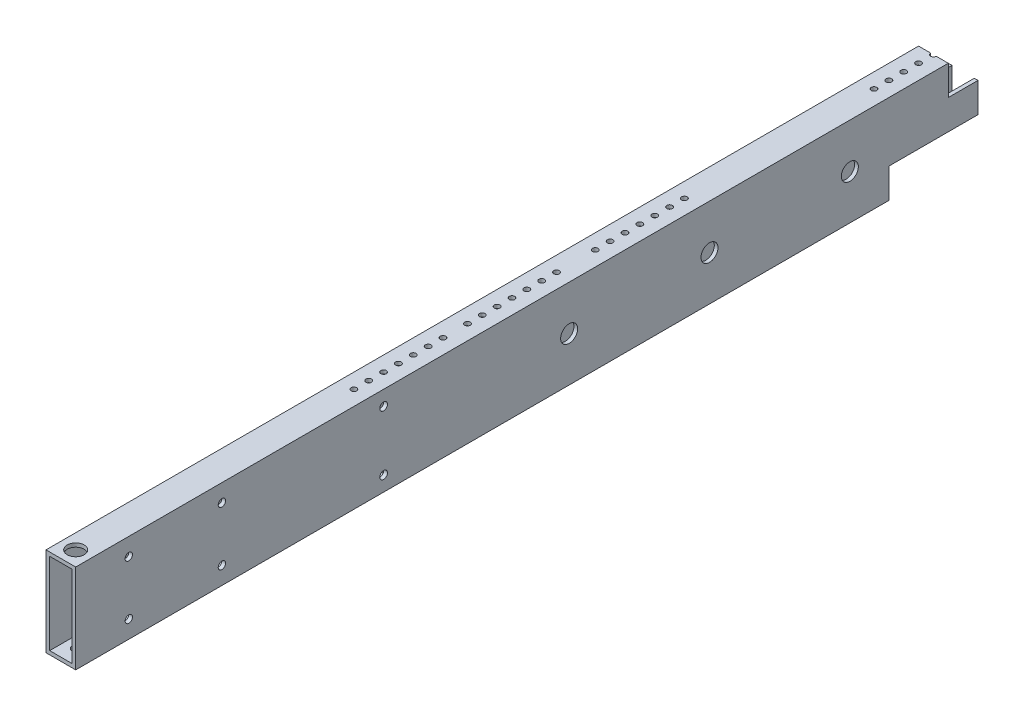
from build123d import *

# Parameters (mm, degrees)
SKETCH1_W                                    = 25.4
SKETCH1_H                                    = 76.2
BOSS_EXTRUDE1_DEPTH                          = 385.699
SHELL1_T                                     = -3.175
SKETCH2_W                                    = 76.2
SKETCH2_H                                    = 25.4
CUT_EXTRUDE1_DEPTH                           = 389.407632007
SKETCH3_W                                    = 25.4
SKETCH3_H                                    = 25.4
CUT_EXTRUDE2_DEPTH                           = 389.407632007
SKETCH4_R                                    = 2.38125
CUT_EXTRUDE3_DEPTH                           = 394.359185225
CUT_EXTRUDE4_REACH                           = 395.359
SKETCH5_R                                    = 2.38125
CUT_EXTRUDE5_REACH                           = 395.359
SKETCH6_R                                    = 2.38125
CBORE_FOR_M6_HEX_HEAD_BOLT1_D                = 6.3
CBORE_FOR_M6_HEX_HEAD_BOLT1_CBORE_D          = 14.547
CBORE_FOR_M6_HEX_HEAD_BOLT1_CBORE_DEPTH      = 4
CBORE_FOR_M6_HEX_HEAD_CAP_SCREW1_D           = 6.6
CBORE_FOR_M6_HEX_HEAD_CAP_SCREW1_CBORE_D     = 14.55
CBORE_FOR_M6_HEX_HEAD_CAP_SCREW1_CBORE_DEPTH = 4.15
CBORE_FOR_M6_HEX_HEAD_CAP_SCREW2_D           = 6.6
CBORE_FOR_M6_HEX_HEAD_CAP_SCREW2_CBORE_D     = 14.55
CBORE_FOR_M6_HEX_HEAD_CAP_SCREW2_CBORE_DEPTH = 4.15
CBORE_FOR_M6_HEX_HEAD_CAP_SCREW3_D           = 6.6
CBORE_FOR_M6_HEX_HEAD_CAP_SCREW3_CBORE_D     = 14.55
CBORE_FOR_M6_HEX_HEAD_CAP_SCREW3_CBORE_DEPTH = 4.15


with BuildPart() as part:
    # Sketch1 → Boss-Extrude1 (new, symmetric)
    with BuildSketch(Plane.XY):
        Rectangle(SKETCH1_W, SKETCH1_H)
    extrude(amount=BOSS_EXTRUDE1_DEPTH, both=True)

    # Shell1
    shell1_openings = [part.faces().sort_by_distance(p)[0] for p in [
        (0, 0, -385.699),
        (0, 0, 385.699),
    ]]
    offset(amount=SHELL1_T, openings=shell1_openings, kind=Kind.INTERSECTION)

    # Sketch2 → Cut-Extrude1 (cut, through all)
    with BuildSketch(Plane(origin=(12.7, 0, 0), x_dir=(0, 0, -1), z_dir=(1, 0, 0))):
        with Locations((347.599, -25.4)):
            Rectangle(SKETCH2_W, SKETCH2_H)
    extrude(amount=-CUT_EXTRUDE1_DEPTH, mode=Mode.SUBTRACT)

    # Sketch3 → Cut-Extrude2 (cut, through all)
    with BuildSketch(Plane(origin=(12.7, 0, 0), x_dir=(0, 0, -1), z_dir=(1, 0, 0))):
        with Locations((372.999, 25.4)):
            Rectangle(SKETCH3_W, SKETCH3_H)
    extrude(amount=-CUT_EXTRUDE2_DEPTH, mode=Mode.SUBTRACT)

    # Sketch4 → Cut-Extrude3 (cut, through all)
    with BuildSketch(Plane(origin=(0, 38.1, 0), x_dir=(1, 0, 0), z_dir=(0, 1, 0))):
        with Locations((0, 147.394483214)):
            Circle(SKETCH4_R)
        with Locations((0, 134.694483214)):
            Circle(SKETCH4_R)
        with Locations((0, 121.994483214)):
            Circle(SKETCH4_R)
        with Locations((0, 109.294483214)):
            Circle(SKETCH4_R)
        with Locations((0, 96.594483214)):
            Circle(SKETCH4_R)
        with Locations((0, 83.894483214)):
            Circle(SKETCH4_R)
        with Locations((0, 71.194483214)):
            Circle(SKETCH4_R)
        with Locations((0, 38.09873)):
            Circle(SKETCH4_R)
        with Locations((0, 25.39873)):
            Circle(SKETCH4_R)
        with Locations((0, 12.69873)):
            Circle(SKETCH4_R)
        with Locations((0, -0.00127)):
            Circle(SKETCH4_R)
        with Locations((0, -12.70127)):
            Circle(SKETCH4_R)
        with Locations((0, -25.40127)):
            Circle(SKETCH4_R)
        with Locations((0, -38.10127)):
            Circle(SKETCH4_R)
        with Locations((0, -58.99324371)):
            Circle(SKETCH4_R)
        with Locations((0, -71.69324371)):
            Circle(SKETCH4_R)
        with Locations((0, -84.39324371)):
            Circle(SKETCH4_R)
        with Locations((0, -97.09324371)):
            Circle(SKETCH4_R)
        with Locations((0, -109.79324371)):
            Circle(SKETCH4_R)
        with Locations((0, -122.49324371)):
            Circle(SKETCH4_R)
        with Locations((0, -135.19324371)):
            Circle(SKETCH4_R)
    extrude(amount=-CUT_EXTRUDE3_DEPTH, mode=Mode.SUBTRACT)

    # Sketch5 → Cut-Extrude4 (cut, up to next)
    with BuildSketch(Plane(origin=(0, 38.1, 0), x_dir=(1, 0, 0), z_dir=(0, 1, 0)), mode=Mode.PRIVATE) as cut_extrude4_sk1:
        with Locations((0, 360.299)):
            Circle(SKETCH5_R)
    cut_extrude4_tool1 = extrude(cut_extrude4_sk1.sketch, amount=-CUT_EXTRUDE4_REACH, mode=Mode.PRIVATE) & part.part
    # Sketch5 → Cut-Extrude4 (cut, up to next)
    with BuildSketch(Plane(origin=(0, 38.1, 0), x_dir=(1, 0, 0), z_dir=(0, 1, 0)), mode=Mode.PRIVATE) as cut_extrude4_sk2:
        with Locations((0, 347.599)):
            Circle(SKETCH5_R)
    cut_extrude4_tool2 = extrude(cut_extrude4_sk2.sketch, amount=-CUT_EXTRUDE4_REACH, mode=Mode.PRIVATE) & part.part
    # Sketch5 → Cut-Extrude4 (cut, up to next)
    with BuildSketch(Plane(origin=(0, 38.1, 0), x_dir=(1, 0, 0), z_dir=(0, 1, 0)), mode=Mode.PRIVATE) as cut_extrude4_sk3:
        with Locations((0, 334.899)):
            Circle(SKETCH5_R)
    cut_extrude4_tool3 = extrude(cut_extrude4_sk3.sketch, amount=-CUT_EXTRUDE4_REACH, mode=Mode.PRIVATE) & part.part
    # Sketch5 → Cut-Extrude4 (cut, up to next)
    with BuildSketch(Plane(origin=(0, 38.1, 0), x_dir=(1, 0, 0), z_dir=(0, 1, 0)), mode=Mode.PRIVATE) as cut_extrude4_sk4:
        with Locations((0, 322.199)):
            Circle(SKETCH5_R)
    cut_extrude4_tool4 = extrude(cut_extrude4_sk4.sketch, amount=-CUT_EXTRUDE4_REACH, mode=Mode.PRIVATE) & part.part
    # Sketch5 → Cut-Extrude4 (cut, up to next)
    with BuildSketch(Plane(origin=(0, 38.1, 0), x_dir=(1, 0, 0), z_dir=(0, 1, 0)), mode=Mode.PRIVATE) as cut_extrude4_sk5:
        with Locations((0, 309.499)):
            Circle(SKETCH5_R)
    cut_extrude4_tool5 = extrude(cut_extrude4_sk5.sketch, amount=-CUT_EXTRUDE4_REACH, mode=Mode.PRIVATE) & part.part
    add(cut_extrude4_tool1.solids().sort_by_distance((0, 38.1, -360.299))[0], mode=Mode.SUBTRACT)
    add(cut_extrude4_tool2.solids().sort_by_distance((0, 38.1, -347.599))[0], mode=Mode.SUBTRACT)
    add(cut_extrude4_tool3.solids().sort_by_distance((0, 38.1, -334.899))[0], mode=Mode.SUBTRACT)
    add(cut_extrude4_tool4.solids().sort_by_distance((0, 38.1, -322.199))[0], mode=Mode.SUBTRACT)
    add(cut_extrude4_tool5.solids().sort_by_distance((0, 38.1, -309.499))[0], mode=Mode.SUBTRACT)

    # Sketch6 → Cut-Extrude5 (cut, up to next)
    with BuildSketch(Plane.XZ.offset(38.1), mode=Mode.PRIVATE) as cut_extrude5_sk1:
        with Locations((0, -309.499)):
            Circle(SKETCH6_R)
    cut_extrude5_tool1 = extrude(cut_extrude5_sk1.sketch, amount=-CUT_EXTRUDE5_REACH, mode=Mode.PRIVATE) & part.part
    # Sketch6 → Cut-Extrude5 (cut, up to next)
    with BuildSketch(Plane.XZ.offset(38.1), mode=Mode.PRIVATE) as cut_extrude5_sk2:
        with Locations((0, -296.799)):
            Circle(SKETCH6_R)
    cut_extrude5_tool2 = extrude(cut_extrude5_sk2.sketch, amount=-CUT_EXTRUDE5_REACH, mode=Mode.PRIVATE) & part.part
    # Sketch6 → Cut-Extrude5 (cut, up to next)
    with BuildSketch(Plane.XZ.offset(38.1), mode=Mode.PRIVATE) as cut_extrude5_sk3:
        with Locations((0, -284.099)):
            Circle(SKETCH6_R)
    cut_extrude5_tool3 = extrude(cut_extrude5_sk3.sketch, amount=-CUT_EXTRUDE5_REACH, mode=Mode.PRIVATE) & part.part
    # Sketch6 → Cut-Extrude5 (cut, up to next)
    with BuildSketch(Plane.XZ.offset(38.1), mode=Mode.PRIVATE) as cut_extrude5_sk4:
        with Locations((0, -258.699)):
            Circle(SKETCH6_R)
    cut_extrude5_tool4 = extrude(cut_extrude5_sk4.sketch, amount=-CUT_EXTRUDE5_REACH, mode=Mode.PRIVATE) & part.part
    # Sketch6 → Cut-Extrude5 (cut, up to next)
    with BuildSketch(Plane.XZ.offset(38.1), mode=Mode.PRIVATE) as cut_extrude5_sk5:
        with Locations((0, -271.399)):
            Circle(SKETCH6_R)
    cut_extrude5_tool5 = extrude(cut_extrude5_sk5.sketch, amount=-CUT_EXTRUDE5_REACH, mode=Mode.PRIVATE) & part.part
    add(cut_extrude5_tool1.solids().sort_by_distance((0, -38.1, -309.499))[0], mode=Mode.SUBTRACT)
    add(cut_extrude5_tool2.solids().sort_by_distance((0, -38.1, -296.799))[0], mode=Mode.SUBTRACT)
    add(cut_extrude5_tool3.solids().sort_by_distance((0, -38.1, -284.099))[0], mode=Mode.SUBTRACT)
    add(cut_extrude5_tool4.solids().sort_by_distance((0, -38.1, -258.699))[0], mode=Mode.SUBTRACT)
    add(cut_extrude5_tool5.solids().sort_by_distance((0, -38.1, -271.399))[0], mode=Mode.SUBTRACT)

    # CBORE for M6 Hex Head Bolt1 (through all)
    with Locations(Plane.ZY.offset(12.7)):
        with Locations((260.7244, 23.1254), (260.7244, -23.1), (340.3244, 23.1254), (340.3244, -23.1)):
            CounterBoreHole(CBORE_FOR_M6_HEX_HEAD_BOLT1_D / 2, CBORE_FOR_M6_HEX_HEAD_BOLT1_CBORE_D / 2, CBORE_FOR_M6_HEX_HEAD_BOLT1_CBORE_DEPTH)

    # CBORE for M6 Hex Head Cap Screw1 (through all)
    with Locations(Plane.ZY.offset(12.7)):
        with Locations((122.46784244, 25.4), (122.46784244, -25.4)):
            CounterBoreHole(CBORE_FOR_M6_HEX_HEAD_CAP_SCREW1_D / 2, CBORE_FOR_M6_HEX_HEAD_CAP_SCREW1_CBORE_D / 2, CBORE_FOR_M6_HEX_HEAD_CAP_SCREW1_CBORE_DEPTH)

    # CBORE for M6 Hex Head Cap Screw2 (through all)
    with Locations(Plane(origin=(0, 38.1, 0), x_dir=(1, 0, 0), z_dir=(0, 1, 0))):
        with Locations((0, -372.999)):
            CounterBoreHole(CBORE_FOR_M6_HEX_HEAD_CAP_SCREW2_D / 2, CBORE_FOR_M6_HEX_HEAD_CAP_SCREW2_CBORE_D / 2, CBORE_FOR_M6_HEX_HEAD_CAP_SCREW2_CBORE_DEPTH)

    # CBORE for M6 Hex Head Cap Screw3 (through all)
    with Locations(Plane(origin=(12.7, 0, 0), x_dir=(0, 0, -1), z_dir=(1, 0, 0))):
        with Locations((36.144871949, 0), (156.144871949, 0), (276.144871949, 0)):
            CounterBoreHole(CBORE_FOR_M6_HEX_HEAD_CAP_SCREW3_D / 2, CBORE_FOR_M6_HEX_HEAD_CAP_SCREW3_CBORE_D / 2, CBORE_FOR_M6_HEX_HEAD_CAP_SCREW3_CBORE_DEPTH)


solid = part.part
